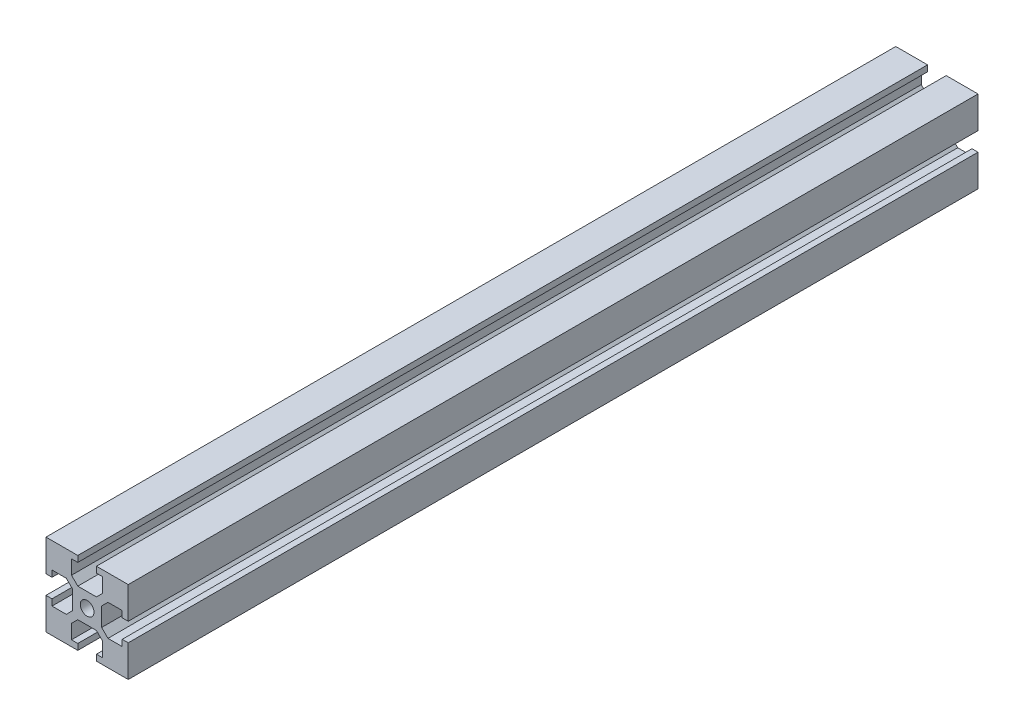
from build123d import *

# Parameters (mm, degrees)
SKETCH_2_R      = 1.25
EXTRUDE_1_DEPTH = 155


with BuildPart() as part:
    # ｽｹｯﾁ2 → ﾎﾞｽ - 押し出し1 (new body)
    with BuildSketch(Plane.XY):
        Polygon((1.7, 2.65), (-1.7, 2.65), (-2.85, 3.8), (-2.85, 6.4), (-1.7, 6.4), (-1.7, 7.5), (-7.5, 7.5), (-7.5, 1.7), (-6.4, 1.7), (-6.4, 2.85), (-3.8, 2.85), (-2.65, 1.7), (-2.65, -1.7), (-3.8, -2.85), (-6.4, -2.85), (-6.4, -1.7), (-7.5, -1.7), (-7.5, -7.5), (-1.7, -7.5), (-1.7, -6.4), (-2.85, -6.4), (-2.85, -3.8), (-1.7, -2.65), (1.7, -2.65), (2.85, -3.8), (2.85, -6.4), (1.7, -6.4), (1.7, -7.5), (7.5, -7.5), (7.5, -1.7), (6.4, -1.7), (6.4, -2.85), (3.8, -2.85), (2.65, -1.7), (2.65, 1.7), (3.8, 2.85), (6.4, 2.85), (6.4, 1.7), (7.5, 1.7), (7.5, 7.5), (1.7, 7.5), (1.7, 6.4), (2.85, 6.4), (2.85, 3.8), align=None)
        Circle(SKETCH_2_R, mode=Mode.SUBTRACT)
    extrude(amount=EXTRUDE_1_DEPTH)


solid = part.part
